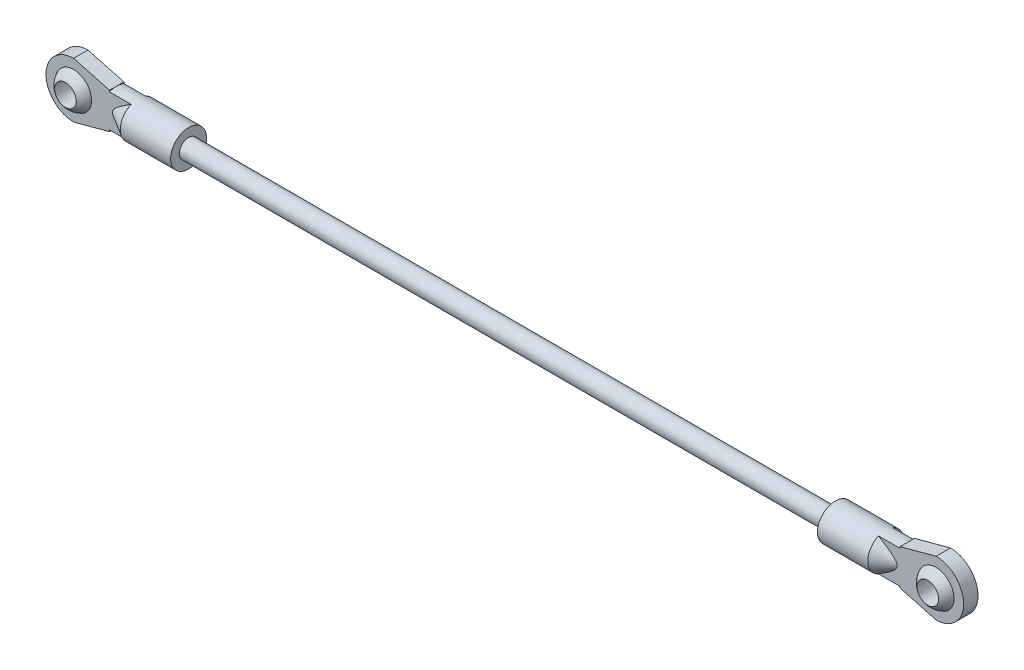
from build123d import *

# Parameters (mm, degrees)
SKETCH_1_W               = 90
SKETCH_1_H               = 1.3
SKETCH_2_R               = 2.5
EXTRUDE_1_DEPTH          = 10
EXTRUDE_START            = 10
SKETCH_3_R               = 2.5
EXTRUDE_2_DEPTH          = 10
EXTRUDE_3_DEPTH          = 1
EXTRUDE_3_DEPTH_BACK     = 1
SKETCH_4_R               = 1.55
EXTRUDE_4_DEPTH          = 2.5
EXTRUDE_4_DEPTH_BACK     = 2.5
SKETCH_5_R               = 2.5
CHAMFER_1_SIZE           = 3
CHAMFER_1_SIZE_2         = 1.732050808
FILLET_1_R               = 2.5
CUT_EXTRUDE_1_DEPTH      = 109.936146208
CUT_EXTRUDE_1_DEPTH_BACK = 109.936146208
SKETCH_6_R               = 1.5


with BuildPart() as part:
    # 草图1 → 旋转1 (revolve)
    with BuildSketch(Plane.XY, mode=Mode.PRIVATE) as revolve_1_sk:
        with Locations((45, 0.65)):
            Rectangle(SKETCH_1_W, SKETCH_1_H)
    revolve(revolve_1_sk.sketch.rotate(Axis((0, 0, 0), (1, 0, 0)), 90), axis=Axis((0, 0, 0), (1, 0, 0)))

    # 草图2 → 凸台-拉伸1 (add)
    with BuildSketch(Plane(origin=(90, 0, 0), x_dir=(0, 0, -1), z_dir=(1, 0, 0))):
        Circle(SKETCH_2_R)
    extrude(amount=EXTRUDE_1_DEPTH)

    # 草图3 → 凸台-拉伸2 (add)
    with BuildSketch(Plane.ZY.offset(EXTRUDE_START)):
        with Locations(Location((0, 0, 0), (0, 0, 180))):
            Circle(SKETCH_3_R)
    extrude(amount=-EXTRUDE_2_DEPTH)

    # 草图4 → 凸台-拉伸3 (add, two sides: drawn at the far end of the back side and taken through both)
    # profile 1 of 2: a face of its own
    with BuildSketch(Plane.XY.offset(-EXTRUDE_3_DEPTH_BACK)):
        with BuildLine():
            Line((100, 2.5), (100, -2.5))
            Line((100, -2.5), (105, -3.839745962))
            ThreePointArc((105, -3.839745962), (108.839745962, 0), (105, 3.839745962))
            Line((105, 3.839745962), (100, 2.5))
        make_face()
        with Locations((105, 0)):
            Circle(SKETCH_4_R, mode=Mode.SUBTRACT)
    # profile 2 of 2: a face of its own
    with BuildSketch(Plane.XY.offset(-EXTRUDE_3_DEPTH_BACK)):
        with BuildLine():
            Line((-10, 2.5), (-15, 3.839745962))
            ThreePointArc((-15, 3.839745962), (-18.839745962, 0), (-15, -3.839745962))
            Line((-15, -3.839745962), (-10, -2.5))
            Line((-10, -2.5), (-10, 2.5))
        make_face()
        with Locations((-15, 0)):
            Circle(SKETCH_4_R, mode=Mode.SUBTRACT)
    extrude(amount=EXTRUDE_3_DEPTH + EXTRUDE_3_DEPTH_BACK)

    # 草图5 → 凸台-拉伸4 (add, two sides: drawn at the far end of the back side and taken through both)
    with BuildSketch(Plane.XY.offset(-EXTRUDE_4_DEPTH_BACK)):
        with Locations((105, 0)):
            Circle(SKETCH_5_R)
        with Locations((-15, 0)):
            Circle(SKETCH_5_R)
    extrude(amount=EXTRUDE_4_DEPTH + EXTRUDE_4_DEPTH_BACK)

    # 倒角1
    # the kernel refuses this chamfer: 3, 1.732050808 mm, written as the material it takes off along each edge
    with BuildSketch(Plane(origin=(100, 0, 0), x_dir=(0, 0, -1), z_dir=(0, -1, 0))) as chamfer_1_piece_1_section:
        Polygon((2.5, -CHAMFER_1_SIZE), (2.5 - CHAMFER_1_SIZE_2, 0), (2.5, 0), align=None)
    chamfer_1_piece_1 = revolve(axis=Axis((100, 0, 0), (1, 0, 0)), revolution_arc=244.335649535, mode=Mode.PRIVATE)
    chamfer_1_piece_1 = split(chamfer_1_piece_1, bisect_by=Plane(origin=(98.91025403, 0.96255065, -1), z_dir=(0, 0, -1)), keep=Keep.TOP, mode=Mode.PRIVATE)
    add(chamfer_1_piece_1, mode=Mode.SUBTRACT)
    with BuildSketch(Plane(origin=(100, 0, 0), x_dir=(0, 0, -1), z_dir=(0, -1, 0))) as chamfer_1_piece_2_section:
        Polygon((2.5, -CHAMFER_1_SIZE), (2.5 - CHAMFER_1_SIZE_2, 0), (2.5, 0), align=None)
    chamfer_1_piece_2 = revolve(axis=Axis((100, 0, 0), (1, 0, 0)), revolution_arc=244.335649535, mode=Mode.PRIVATE)
    chamfer_1_piece_2 = split(chamfer_1_piece_2, bisect_by=Plane(origin=(98.892055311, -0.028025322, 1), z_dir=(0, 0, 1)), keep=Keep.TOP, mode=Mode.PRIVATE)
    add(chamfer_1_piece_2, mode=Mode.SUBTRACT)
    with BuildSketch(Plane(origin=(100, 0, 0), x_dir=(0, 0.003141587485879368, -0.9999950652018581), z_dir=(0, -0.9999950652018581, -0.003141587485879368))) as chamfer_1_piece_3_section:
        Polygon((2.5, -CHAMFER_1_SIZE), (2.5 - CHAMFER_1_SIZE_2, 0), (2.5, 0), align=None)
    chamfer_1_piece_3 = revolve(axis=Axis((100, 0, 0), (1, 0, 0)), revolution_arc=359.64, mode=Mode.PRIVATE)
    chamfer_1_piece_3 = split(chamfer_1_piece_3, bisect_by=Plane(origin=(98.910233235, 0.965609903, -1), z_dir=(0, 0, -1)), keep=Keep.TOP, mode=Mode.PRIVATE)
    add(chamfer_1_piece_3, mode=Mode.SUBTRACT)
    with BuildSketch(Plane(origin=(100, 0, 0), x_dir=(0, 0.003141587485879368, -0.9999950652018581), z_dir=(0, -0.9999950652018581, -0.003141587485879368))) as chamfer_1_piece_4_section:
        Polygon((2.5, -CHAMFER_1_SIZE), (2.5 - CHAMFER_1_SIZE_2, 0), (2.5, 0), align=None)
    chamfer_1_piece_4 = revolve(axis=Axis((100, 0, 0), (1, 0, 0)), revolution_arc=359.64, mode=Mode.PRIVATE)
    chamfer_1_piece_4 = split(chamfer_1_piece_4, bisect_by=Plane(origin=(98.91025403, -2e-09, 1), z_dir=(0, 0, 1)), keep=Keep.TOP, mode=Mode.PRIVATE)
    add(chamfer_1_piece_4, mode=Mode.SUBTRACT)
    with BuildSketch(Plane(origin=(-10, 0, 0), x_dir=(0, 0, -1), z_dir=(0, 1, 0))) as chamfer_1_piece_5_section:
        Polygon((2.5, -CHAMFER_1_SIZE), (2.5 - CHAMFER_1_SIZE_2, 0), (2.5, 0), align=None)
    chamfer_1_piece_5 = revolve(axis=Axis((-10, 0, 0), (-1, 0, 0)), revolution_arc=244.335649535, mode=Mode.PRIVATE)
    chamfer_1_piece_5 = split(chamfer_1_piece_5, bisect_by=Plane(origin=(-8.91025403, -0.96255065, -1), z_dir=(0, 0, -1)), keep=Keep.TOP, mode=Mode.PRIVATE)
    add(chamfer_1_piece_5, mode=Mode.SUBTRACT)
    with BuildSketch(Plane(origin=(-10, 0, 0), x_dir=(0, 0, -1), z_dir=(0, 1, 0))) as chamfer_1_piece_6_section:
        Polygon((2.5, -CHAMFER_1_SIZE), (2.5 - CHAMFER_1_SIZE_2, 0), (2.5, 0), align=None)
    chamfer_1_piece_6 = revolve(axis=Axis((-10, 0, 0), (-1, 0, 0)), revolution_arc=244.335649535, mode=Mode.PRIVATE)
    chamfer_1_piece_6 = split(chamfer_1_piece_6, bisect_by=Plane(origin=(-8.892055311, 0.028025322, 1), z_dir=(0, 0, 1)), keep=Keep.TOP, mode=Mode.PRIVATE)
    add(chamfer_1_piece_6, mode=Mode.SUBTRACT)
    with BuildSketch(Plane(origin=(-10, 0, 0), x_dir=(0, -0.0031415874858794677, -0.9999950652018581), z_dir=(0, 0.9999950652018581, -0.0031415874858794677))) as chamfer_1_piece_7_section:
        Polygon((2.5, -CHAMFER_1_SIZE), (2.5 - CHAMFER_1_SIZE_2, 0), (2.5, 0), align=None)
    chamfer_1_piece_7 = revolve(axis=Axis((-10, 0, 0), (-1, 0, 0)), revolution_arc=359.64, mode=Mode.PRIVATE)
    chamfer_1_piece_7 = split(chamfer_1_piece_7, bisect_by=Plane(origin=(-8.910233235, -0.965609903, -1), z_dir=(0, 0, -1)), keep=Keep.TOP, mode=Mode.PRIVATE)
    add(chamfer_1_piece_7, mode=Mode.SUBTRACT)
    with BuildSketch(Plane(origin=(-10, 0, 0), x_dir=(0, -0.0031415874858794677, -0.9999950652018581), z_dir=(0, 0.9999950652018581, -0.0031415874858794677))) as chamfer_1_piece_8_section:
        Polygon((2.5, -CHAMFER_1_SIZE), (2.5 - CHAMFER_1_SIZE_2, 0), (2.5, 0), align=None)
    chamfer_1_piece_8 = revolve(axis=Axis((-10, 0, 0), (-1, 0, 0)), revolution_arc=359.64, mode=Mode.PRIVATE)
    chamfer_1_piece_8 = split(chamfer_1_piece_8, bisect_by=Plane(origin=(-8.91025403, 2e-09, 1), z_dir=(0, 0, 1)), keep=Keep.TOP, mode=Mode.PRIVATE)
    add(chamfer_1_piece_8, mode=Mode.SUBTRACT)
    with BuildSketch(Plane(origin=(-10, 0, 0), x_dir=(0, -0.901346670332976, 0.43309834896898114), z_dir=(0, -0.43309834896898114, -0.901346670332976))) as chamfer_1_piece_9_section:
        Polygon((2.5, -CHAMFER_1_SIZE), (2.5 - CHAMFER_1_SIZE_2, 0), (2.5, 0), align=None)
    chamfer_1_piece_9 = revolve(axis=Axis((-10, 0, 0), (-1, 0, 0)), revolution_arc=244.335649535, mode=Mode.PRIVATE)
    chamfer_1_piece_9 = split(chamfer_1_piece_9, bisect_by=Plane(origin=(-8.89205531, -0.028025322, 1), z_dir=(0, 0, 1)), keep=Keep.TOP, mode=Mode.PRIVATE)
    add(chamfer_1_piece_9, mode=Mode.SUBTRACT)
    with BuildSketch(Plane(origin=(-10, 0, 0), x_dir=(0, -0.901346670332976, 0.43309834896898114), z_dir=(0, -0.43309834896898114, -0.901346670332976))) as chamfer_1_piece_10_section:
        Polygon((2.5, -CHAMFER_1_SIZE), (2.5 - CHAMFER_1_SIZE_2, 0), (2.5, 0), align=None)
    chamfer_1_piece_10 = revolve(axis=Axis((-10, 0, 0), (-1, 0, 0)), revolution_arc=244.335649535, mode=Mode.PRIVATE)
    chamfer_1_piece_10 = split(chamfer_1_piece_10, bisect_by=Plane(origin=(-8.910254031, 0.96255065, -1), z_dir=(0, 0, -1)), keep=Keep.TOP, mode=Mode.PRIVATE)
    add(chamfer_1_piece_10, mode=Mode.SUBTRACT)
    with BuildSketch(Plane(origin=(100, 0, 0), x_dir=(0, 0.9013466703329771, 0.43309834896897925), z_dir=(0, 0.43309834896897925, -0.9013466703329771))) as chamfer_1_piece_11_section:
        Polygon((2.5, -CHAMFER_1_SIZE), (2.5 - CHAMFER_1_SIZE_2, 0), (2.5, 0), align=None)
    chamfer_1_piece_11 = revolve(axis=Axis((100, 0, 0), (1, 0, 0)), revolution_arc=244.335649535, mode=Mode.PRIVATE)
    chamfer_1_piece_11 = split(chamfer_1_piece_11, bisect_by=Plane(origin=(98.89205531, 0.028025322, 1), z_dir=(0, 0, 1)), keep=Keep.TOP, mode=Mode.PRIVATE)
    add(chamfer_1_piece_11, mode=Mode.SUBTRACT)
    with BuildSketch(Plane(origin=(100, 0, 0), x_dir=(0, 0.9013466703329771, 0.43309834896897925), z_dir=(0, 0.43309834896897925, -0.9013466703329771))) as chamfer_1_piece_12_section:
        Polygon((2.5, -CHAMFER_1_SIZE), (2.5 - CHAMFER_1_SIZE_2, 0), (2.5, 0), align=None)
    chamfer_1_piece_12 = revolve(axis=Axis((100, 0, 0), (1, 0, 0)), revolution_arc=244.335649535, mode=Mode.PRIVATE)
    chamfer_1_piece_12 = split(chamfer_1_piece_12, bisect_by=Plane(origin=(98.910254031, -0.96255065, -1), z_dir=(0, 0, -1)), keep=Keep.TOP, mode=Mode.PRIVATE)
    add(chamfer_1_piece_12, mode=Mode.SUBTRACT)

    # 圆角1
    # the kernel refuses this fillet: 2.5 mm, written as the material it takes off along each edge
    with BuildSketch(Plane(origin=(105, 0, -2.5), x_dir=(1, 0, 0), z_dir=(0, -1, 0))) as fillet_1_piece_1:
        with BuildLine():
            CenterArc((0.208712153, 2.5), FILLET_1_R, 270, 66.421821522)
            Line((0.208712153, 0), (0.208712153, -0.05))
            Line((0.208712153, -0.05), (2.5, -0.05))
            Line((2.5, -0.05), (2.55, 0))
            ThreePointArc((2.55, 0), (2.55, 0.75), (2.545825757, 1.48))
            Line((2.545825757, 1.48), (2.5, 1.5))
        make_face()
    revolve(axis=Axis((105, 0, -2.5), (0, 0, 1)), mode=Mode.SUBTRACT)
    with BuildSketch(Plane(origin=(105, 0, 2.5), x_dir=(1, 0, 0), z_dir=(0, -1, 0))) as fillet_1_piece_2:
        with BuildLine():
            CenterArc((0.208712153, -2.5), FILLET_1_R, 23.578178478, 66.421821522)
            Line((0.208712153, 0), (0.208712153, 0.05))
            Line((0.208712153, 0.05), (2.5, 0.05))
            Line((2.5, 0.05), (2.55, 0))
            ThreePointArc((2.55, 0), (2.55, -0.75), (2.545825757, -1.48))
            Line((2.545825757, -1.48), (2.5, -1.5))
        make_face()
    revolve(axis=Axis((105, 0, 2.5), (0, 0, 1)), mode=Mode.SUBTRACT)
    with BuildSketch(Plane(origin=(-15, 0, -2.5), x_dir=(1, 0, 0), z_dir=(0, -1, 0))) as fillet_1_piece_3:
        with BuildLine():
            CenterArc((0.208712153, 2.5), FILLET_1_R, 270, 66.421821522)
            Line((0.208712153, 0), (0.208712153, -0.05))
            Line((0.208712153, -0.05), (2.5, -0.05))
            Line((2.5, -0.05), (2.55, 0))
            ThreePointArc((2.55, 0), (2.55, 0.75), (2.545825757, 1.48))
            Line((2.545825757, 1.48), (2.5, 1.5))
        make_face()
    revolve(axis=Axis((-15, 0, -2.5), (0, 0, 1)), mode=Mode.SUBTRACT)
    with BuildSketch(Plane(origin=(-15, 0, 2.5), x_dir=(1, 0, 0), z_dir=(0, -1, 0))) as fillet_1_piece_4:
        with BuildLine():
            CenterArc((0.208712153, -2.5), FILLET_1_R, 23.578178478, 66.421821522)
            Line((0.208712153, 0), (0.208712153, 0.05))
            Line((0.208712153, 0.05), (2.5, 0.05))
            Line((2.5, 0.05), (2.55, 0))
            ThreePointArc((2.55, 0), (2.55, -0.75), (2.545825757, -1.48))
            Line((2.545825757, -1.48), (2.5, -1.5))
        make_face()
    revolve(axis=Axis((-15, 0, 2.5), (0, 0, 1)), mode=Mode.SUBTRACT)

    # 草图6 → 切除-拉伸1 (cut, two sides: drawn at the far end of the back side and taken through both)
    with BuildSketch(Plane.XY.offset(-CUT_EXTRUDE_1_DEPTH_BACK)):
        with Locations((-15, 0)):
            Circle(SKETCH_6_R)
        with Locations(Location((105, 0, 0), (0, 0, 180))):
            Circle(SKETCH_6_R)
    extrude(amount=CUT_EXTRUDE_1_DEPTH + CUT_EXTRUDE_1_DEPTH_BACK, mode=Mode.SUBTRACT)


solid = part.part
